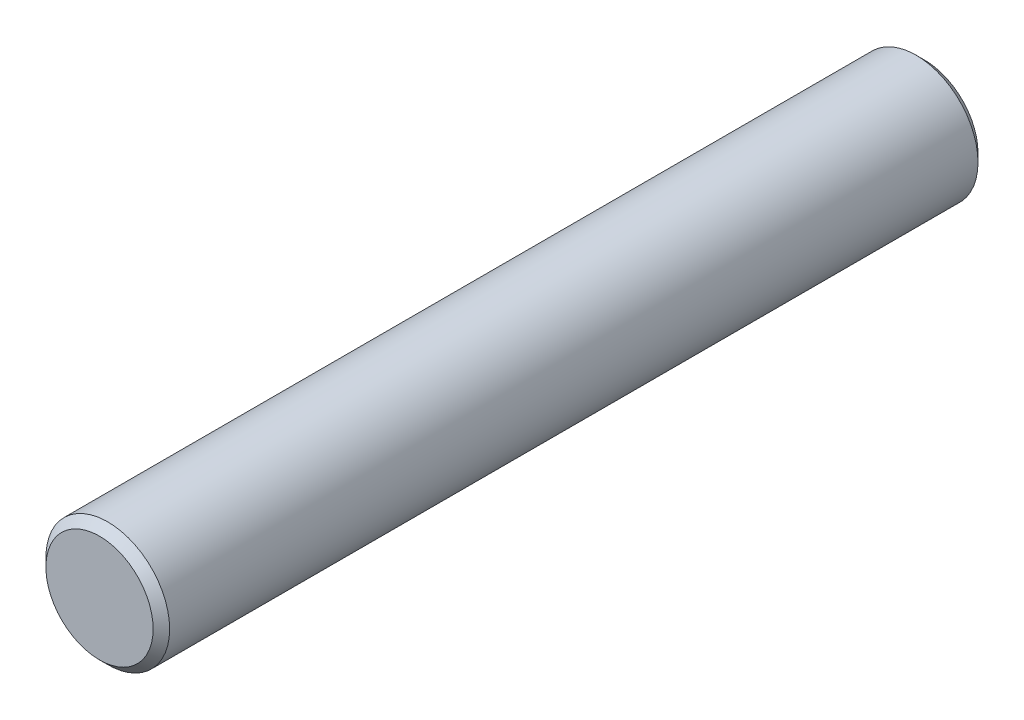
from build123d import *

# Parameters (mm, degrees)
SKETCH_1_R      = 1.5
EXTRUDE_1_DEPTH = 20
CHAMFER_1_SIZE  = 0.2


with BuildPart() as part:
    # 草图1 → 凸台-拉伸1 (new body)
    with BuildSketch(Plane.XY):
        Circle(SKETCH_1_R)
    extrude(amount=EXTRUDE_1_DEPTH)

    # 倒角1
    chamfer_1_edges = [part.edges().sort_by_distance(p)[0] for p in [
        (-1.5, 0, 0),
        (-1.5, 0, 20),
    ]]
    chamfer(chamfer_1_edges, length=CHAMFER_1_SIZE)


solid = part.part
